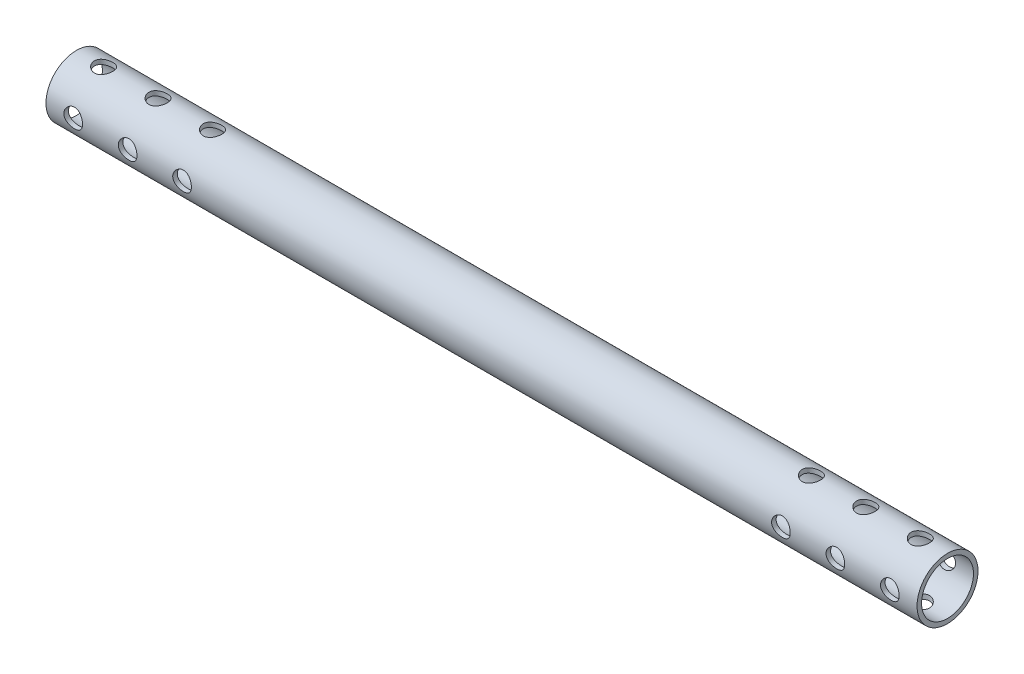
from build123d import *

# Parameters (mm, degrees)
SKETCH1_R               = 10.668
SKETCH1_R_2             = 9.0805
BOSS_EXTRUDE1_DEPTH     = 304.8
CUT_EXTRUDE1_DEPTH      = 306.686133882
CUT_EXTRUDE1_DEPTH_BACK = 306.686133882
SKETCH2_R               = 3.2639
CUT_EXTRUDE2_DEPTH      = 306.173151691
CUT_EXTRUDE2_DEPTH_BACK = 306.173151691
SKETCH3_R               = 3.221686024


with BuildPart() as part:
    # Sketch1 → Boss-Extrude1 (new body)
    with BuildSketch(Plane(origin=(0, 0, 0), x_dir=(0, 0, -1), z_dir=(1, 0, 0))):
        Circle(SKETCH1_R)
        Circle(SKETCH1_R_2, mode=Mode.SUBTRACT)
    extrude(amount=BOSS_EXTRUDE1_DEPTH)

    # Sketch2 → Cut-Extrude1 (cut, two sides: drawn at the far end of the back side and taken through both)
    with BuildSketch(Plane.XY.offset(10).offset(-CUT_EXTRUDE1_DEPTH_BACK)):
        with Locations((9.525, 0)):
            Circle(SKETCH2_R)
        with Locations((28.575, 0)):
            Circle(SKETCH2_R)
        with Locations((47.625, 0)):
            Circle(SKETCH2_R)
        with Locations((295.275, 0)):
            Circle(SKETCH2_R)
        with Locations((276.225, 0)):
            Circle(SKETCH2_R)
        with Locations((257.175, 0)):
            Circle(SKETCH2_R)
    extrude(amount=CUT_EXTRUDE1_DEPTH + CUT_EXTRUDE1_DEPTH_BACK, mode=Mode.SUBTRACT)

    # Sketch3 → Cut-Extrude2 (cut, two sides: drawn at the far end of the back side and taken through both)
    with BuildSketch(Plane(origin=(0, 0, 0), x_dir=(1, 0, 0), z_dir=(0, 1, 0)).offset(-CUT_EXTRUDE2_DEPTH_BACK)):
        with Locations((295.275, 0)):
            Circle(SKETCH3_R)
        with Locations((276.225, 0)):
            Circle(SKETCH3_R)
        with Locations((257.175, 0)):
            Circle(SKETCH3_R)
        with Locations((47.625, 0)):
            Circle(SKETCH3_R)
        with Locations((28.575, 0)):
            Circle(SKETCH3_R)
        with Locations((9.525, 0)):
            Circle(SKETCH3_R)
    extrude(amount=CUT_EXTRUDE2_DEPTH + CUT_EXTRUDE2_DEPTH_BACK, mode=Mode.SUBTRACT)


solid = part.part
